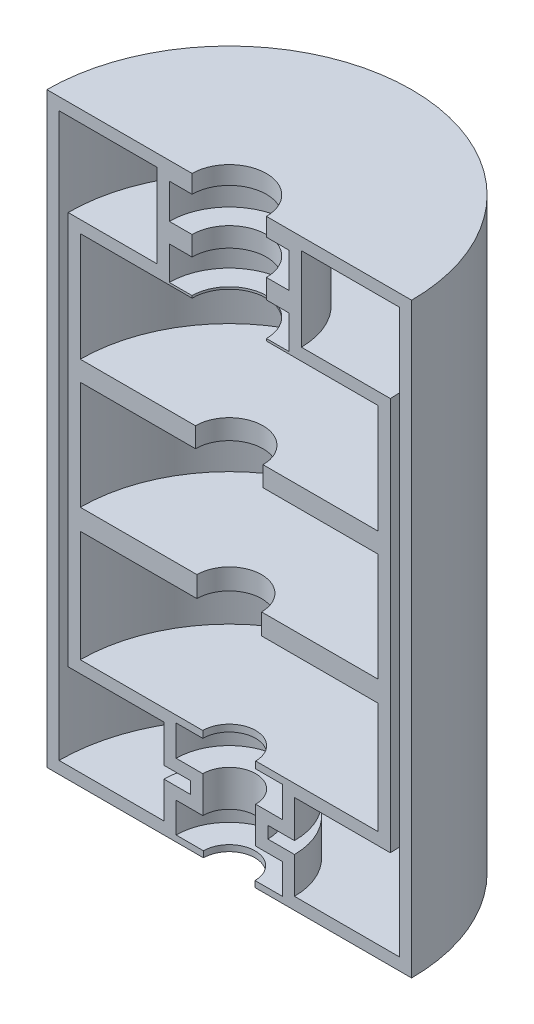
from build123d import *

# Parameters (mm, degrees)
REVOLVE1_ANGLE = 180
SHELL1_START   = -239.158306138
SHELL1_DEPTH   = 42.206593174
SHELL1_START_2 = -3.058115052
SHELL1_2_DEPTH = 41.216014124
SHELL1_START_3 = -196.951712964
SHELL1_3_DEPTH = 193.893597912
SHELL1_START_4 = -221.288155922
SHELL1_4_DEPTH = 5.892364499


# Read off the part's stored shape, not the designer's step: Shell1
with BuildPart() as part:
    # Sketch1 → Revolve1 (revolve)
    with BuildSketch(Plane.XY):
        Polygon((89.874416534, -245.158306138), (12.7, -245.158306138), (12.7, -242.138884915), (26.163339875, -242.138884915), (26.163339875, -227.288155922), (13.03850974, -227.288155922), (13.03850974, -209.395791423), (26.163339875, -209.395791423), (26.163339875, -194.322320246), (13.03850974, -194.322320246), (13.03850974, -190.951712964), (73.402730944, -190.951712964), (73.402730944, -136.120329582), (15.924443856, -136.120329582), (15.924443856, -125.873058549), (73.402730944, -125.873058549), (73.402730944, -72.501855253), (16.640249143, -72.501855253), (16.640249143, -62.681553847), (73.402730944, -62.681553847), (73.402730944, -9.058115052), (18.31208302, -9.058115052), (18.31208302, -7.976977068), (29.551500324, -7.976977068), (29.551500324, 8.480345585), (18.31208302, 8.480345585), (18.31208302, 18.090461002), (29.551500324, 18.090461002), (29.551500324, 35.26854231), (18.31208302, 35.26854231), (18.31208302, 44.157899072), (89.874416534, 44.157899072), align=None)
    revolve(axis=Axis((0, 19.84375, 0), (0, 1, 0)), revolution_arc=REVOLVE1_ANGLE)

    # Shell1 outline → Shell1 (cut)
    with BuildSketch(Plane(origin=(0, 0, 0), x_dir=(1, 0, 0), z_dir=(0, 1, 0)).offset(SHELL1_START)):
        with BuildLine():
            ThreePointArc((83.874416534, 0), (0, 83.874416534), (-83.874416534, 0))
            Line((-83.874416534, 0), (-32.163339875, 0))
            ThreePointArc((-32.163339875, 0), (0, 32.163339875), (32.163339875, 0))
            Line((32.163339875, 0), (83.874416534, 0))
        make_face()
    extrude(amount=SHELL1_DEPTH, mode=Mode.SUBTRACT)

    # Shell1 2 outline → Shell1 2 (cut)
    with BuildSketch(Plane(origin=(0, 0, 0), x_dir=(1, 0, 0), z_dir=(0, 1, 0)).offset(SHELL1_START_2)):
        with BuildLine():
            ThreePointArc((83.874416534, 0), (0, 83.874416534), (-83.874416534, 0))
            Line((-83.874416534, 0), (-35.551500324, 0))
            ThreePointArc((-35.551500324, 0), (0, 35.551500324), (35.551500324, 0))
            Line((35.551500324, 0), (83.874416534, 0))
        make_face()
    extrude(amount=SHELL1_2_DEPTH, mode=Mode.SUBTRACT)

    # Shell1 3 outline → Shell1 3 (cut)
    with BuildSketch(Plane(origin=(0, 0, 0), x_dir=(1, 0, 0), z_dir=(0, 1, 0)).offset(SHELL1_START_3)):
        with BuildLine():
            ThreePointArc((83.874416534, 0), (0, 83.874416534), (-83.874416534, 0))
            Line((-83.874416534, 0), (-79.402730944, 0))
            ThreePointArc((-79.402730944, 0), (0, 79.402730944), (79.402730944, 0))
            Line((79.402730944, 0), (83.874416534, 0))
        make_face()
    extrude(amount=SHELL1_3_DEPTH, mode=Mode.SUBTRACT)

    # Shell1 4 outline → Shell1 4 (cut)
    with BuildSketch(Plane(origin=(0, 0, 0), x_dir=(1, 0, 0), z_dir=(0, 1, 0)).offset(SHELL1_START_4)):
        with BuildLine():
            ThreePointArc((32.163339875, 0), (0, 32.163339875), (-32.163339875, 0))
            Line((-32.163339875, 0), (-19.03850974, 0))
            ThreePointArc((-19.03850974, 0), (0, 19.03850974), (19.03850974, 0))
            Line((19.03850974, 0), (32.163339875, 0))
        make_face()
    extrude(amount=SHELL1_4_DEPTH, mode=Mode.SUBTRACT)


solid = part.part
